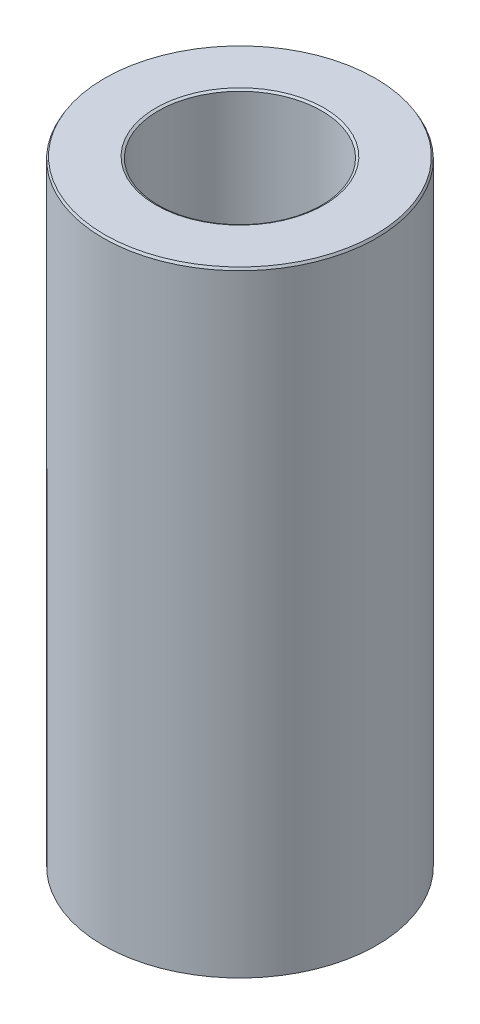
from build123d import *
from OCP.BRepFilletAPI import BRepFilletAPI_MakeChamfer

# Parameters (mm, degrees)
SKETCH1_R           = 57.5
BOSS_EXTRUDE1_DEPTH = 259.087044068
SKETCH2_R           = 34.375905425
CUT_EXTRUDE1_DEPTH  = 272.548515746
CHAMFER1_SIZE       = 0.982477305
CHAMFER1_SIZE2      = 0.567233537


with BuildPart() as part:
    # Sketch1 → Boss-Extrude1 (new body)
    with BuildSketch(Plane(origin=(0, 0, 0), x_dir=(1, 0, 0), z_dir=(0, 1, 0))):
        Circle(SKETCH1_R)
    extrude(amount=BOSS_EXTRUDE1_DEPTH)

    # Sketch2 → Cut-Extrude1 (cut, through all)
    with BuildSketch(Plane(origin=(0, 0, 0), x_dir=(1, 0, 0), z_dir=(0, 1, 0))):
        Circle(SKETCH2_R)
    extrude(amount=CUT_EXTRUDE1_DEPTH, mode=Mode.SUBTRACT)

    # Chamfer1: one chamfer whose edges measure the first distance from different faces: ONE call of the kernel's chamfer builder (chamfer() names one face for all edges)
    chamfer1_edges_1 = [part.edges().sort_by_distance(p)[0] for p in [
        (-34.375905425, 259.087044068, 0),
    ]]
    chamfer1_side_1 = [part.faces().sort_by_distance(p)[0] for p in [
        (-55.873654403, 259.087044068, 0),
    ]]
    chamfer1_edges_2 = [part.edges().sort_by_distance(p)[0] for p in [
        (-34.375905425, 0, 0),
    ]]
    chamfer1_side_2 = [part.faces().sort_by_distance(p)[0] for p in [
        (-34.375905425, 129.543522034, 0),
    ]]
    chamfer1_edges_3 = [part.edges().sort_by_distance(p)[0] for p in [
        (-57.5, 0, 0),
    ]]
    chamfer1_side_3 = [part.faces().sort_by_distance(p)[0] for p in [
        (-55.873654403, 0, 0),
    ]]
    chamfer1_edges_4 = [part.edges().sort_by_distance(p)[0] for p in [
        (-57.5, 259.087044068, 0),
    ]]
    chamfer1_side_4 = [part.faces().sort_by_distance(p)[0] for p in [
        (-57.5, 129.543522034, 0),
    ]]
    chamfer1 = BRepFilletAPI_MakeChamfer(part.part.solid().wrapped)
    for e in chamfer1_edges_1:
        chamfer1.Add(CHAMFER1_SIZE, CHAMFER1_SIZE2, e.wrapped, chamfer1_side_1[0].wrapped)  # the first distance lies on this face
    for e in chamfer1_edges_2:
        chamfer1.Add(CHAMFER1_SIZE, CHAMFER1_SIZE2, e.wrapped, chamfer1_side_2[0].wrapped)  # the first distance lies on this face
    for e in chamfer1_edges_3:
        chamfer1.Add(CHAMFER1_SIZE, CHAMFER1_SIZE2, e.wrapped, chamfer1_side_3[0].wrapped)  # the first distance lies on this face
    for e in chamfer1_edges_4:
        chamfer1.Add(CHAMFER1_SIZE, CHAMFER1_SIZE2, e.wrapped, chamfer1_side_4[0].wrapped)  # the first distance lies on this face
    add(Compound.cast(chamfer1.Shape()), mode=Mode.REPLACE)


solid = part.part
